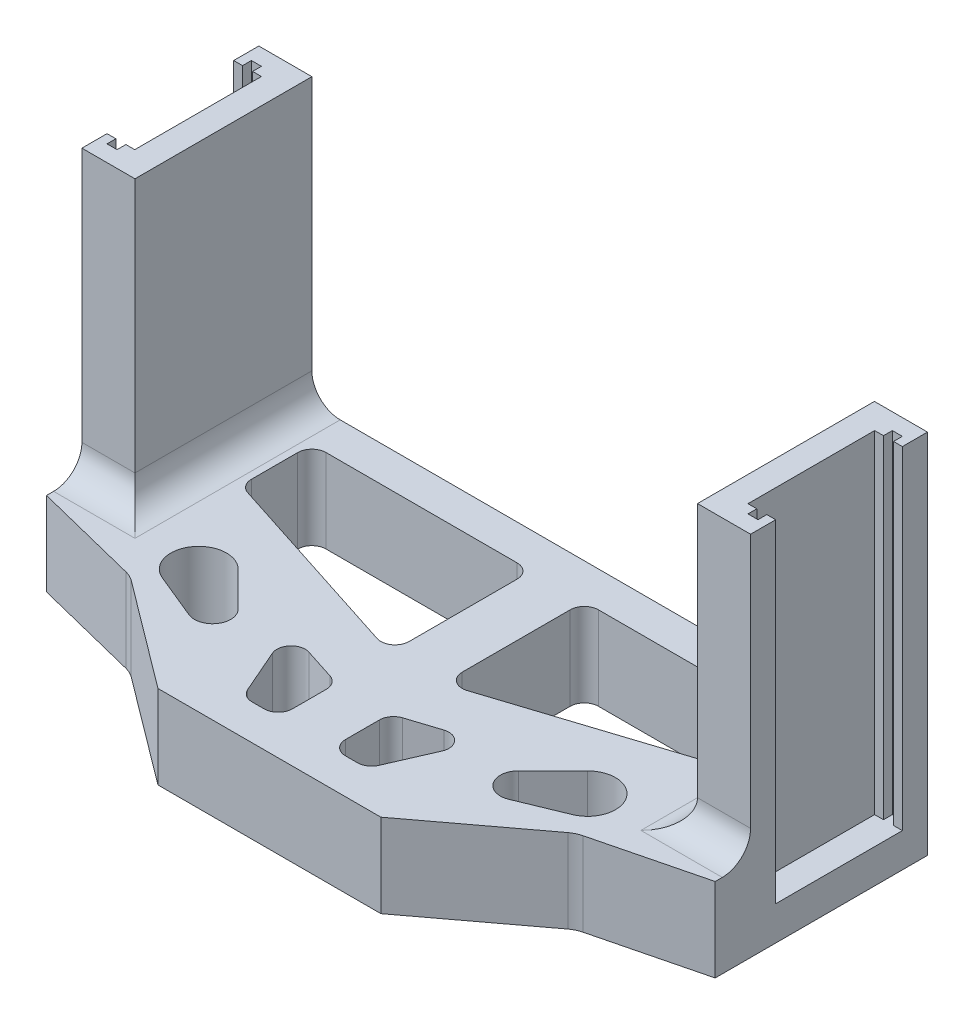
from build123d import *

# Parameters (mm, degrees)
BOSS_EXTRUDE4_DEPTH = 15
CUT_EXTRUDE1_DEPTH  = 73.640278083
SKETCH10_W          = 9.525
SKETCH10_H          = 31.75
BOSS_EXTRUDE5_DEPTH = 50.8
CUT_EXTRUDE2_DEPTH  = 59.69
CUT_EXTRUDE3_DEPTH  = 88.362749499
FILLET2_R           = 5.08
FILLET3_R           = 2.54


with BuildPart() as part:
    # Sketch8 → Boss-Extrude4 (new body)
    with BuildSketch(Plane(origin=(0, 0, 0), x_dir=(1, 0, 0), z_dir=(0, 1, 0))):
        Polygon((-20, -20), (20, -20), (40, -5), (60, 0), (60, 38.1), (-60, 38.1), (-60, 0), (-40, -5), align=None)
    extrude(amount=BOSS_EXTRUDE4_DEPTH)

    # Sketch9 → Cut-Extrude1 (cut, through all)
    with BuildSketch(Plane(origin=(0, 15, 0), x_dir=(1, 0, 0), z_dir=(0, 1, 0))):
        with BuildLine():
            Line((25.154735358, -0.449074051), (31.368823628, 5.749724782))
            ThreePointArc((31.368823628, 5.749724782), (39.062011173, 4.98069832), (36.803574238, -2.413623753))
            Line((36.803574238, -2.413623753), (28.687323255, -5.755250599))
            ThreePointArc((28.687323255, -5.755250599), (24.744692737, -4.551058748), (25.154735358, -0.449074051))
        make_face()
        with BuildLine():
            Line((-28.687323255, -5.755250599), (-36.803574238, -2.413623753))
            ThreePointArc((-36.803574238, -2.413623753), (-39.062011173, 4.98069832), (-31.368823628, 5.749724782))
            Line((-31.368823628, 5.749724782), (-25.154735358, -0.449074051))
            ThreePointArc((-25.154735358, -0.449074051), (-24.744692737, -4.551058748), (-28.687323255, -5.755250599))
        make_face()
    extrude(amount=-CUT_EXTRUDE1_DEPTH, mode=Mode.SUBTRACT)

    # Sketch10 → Boss-Extrude5 (add)
    with BuildSketch(Plane(origin=(0, 15, 0), x_dir=(1, 0, 0), z_dir=(0, 1, 0))):
        with Locations((55.2375, 22.225)):
            Rectangle(SKETCH10_W, SKETCH10_H)
    boss_extrude5 = extrude(amount=BOSS_EXTRUDE5_DEPTH)

    # Sketch11 → Cut-Extrude2 (cut)
    with BuildSketch(Plane(origin=(0, 65.8, 0), x_dir=(1, 0, 0), z_dir=(0, 1, 0))):
        Polygon((60, 10.8585), (60, 33.5915), (58.4125, 33.5915), (58.4125, 35.179), (56.6125, 35.179), (56.6125, 33.5915), (55.025, 33.5915), (55.025, 10.8585), (56.6125, 10.8585), (56.6125, 9.271), (58.4125, 9.271), (58.4125, 10.8585), align=None)
    cut_extrude2 = extrude(amount=-CUT_EXTRUDE2_DEPTH, mode=Mode.SUBTRACT)

    # Mirror1: Boss-Extrude5, Cut-Extrude2 across plane
    add(boss_extrude5.mirror(Plane(origin=(0, 0, 0), x_dir=(0, 0, 1), z_dir=(1, 0, 0))))
    add(cut_extrude2.mirror(Plane(origin=(0, 0, 0), x_dir=(0, 0, 1), z_dir=(1, 0, 0))), mode=Mode.SUBTRACT)

    # Sketch12 → Cut-Extrude3 (cut, through all)
    with BuildSketch(Plane(origin=(0, 15, 0), x_dir=(1, 0, 0), z_dir=(0, 1, 0))):
        Polygon((4.7625, 6.35), (44.125, 19.05), (44.125, 31.75), (4.7625, 31.75), align=None)
        Polygon((-4.7625, 31.75), (-4.7625, 6.35), (-44.125, 19.05), (-44.125, 31.75), align=None)
        Polygon((-4.7625, -3.175), (-17.4625, 0.922554779), (-11.1125, -13.65), (-4.7625, -13.65), align=None)
        Polygon((4.7625, -13.65), (4.7625, -3.175), (17.4625, 0.922554779), (11.1125, -13.65), align=None)
    extrude(amount=-CUT_EXTRUDE3_DEPTH, mode=Mode.SUBTRACT)

    # Fillet2
    fillet2_edges = [part.edges().sort_by_distance(p)[0] for p in [
        (40, 7.5, 5),
        (-40, 7.5, 5),
        (55.2375, 15, -6.35),
        (50.475, 15, -22.225),
        (-50.475, 15, -22.225),
        (-55.2375, 15, -6.35),
    ]]
    fillet(fillet2_edges, radius=FILLET2_R)

    # Fillet3
    fillet3_edges = [part.edges().sort_by_distance(p)[0] for p in [
        (-11.1125, 7.5, 13.65),
        (-4.7625, 7.5, 3.175),
        (-4.7625, 7.5, 13.65),
        (4.7625, 7.5, 13.65),
        (44.125, 7.5, -31.75),
        (44.125, 7.5, -19.05),
        (11.1125, 7.5, 13.65),
        (17.4625, 7.5, -0.922554779),
        (4.7625, 7.5, 3.175),
        (4.7625, 7.5, -6.35),
        (-4.7625, 7.5, -6.35),
        (-17.4625, 7.5, -0.922554779),
        (4.7625, 7.5, -31.75),
        (-4.7625, 7.5, -31.75),
        (-44.125, 7.5, -31.75),
        (-44.125, 7.5, -19.05),
    ]]
    fillet(fillet3_edges, radius=FILLET3_R)


solid = part.part
